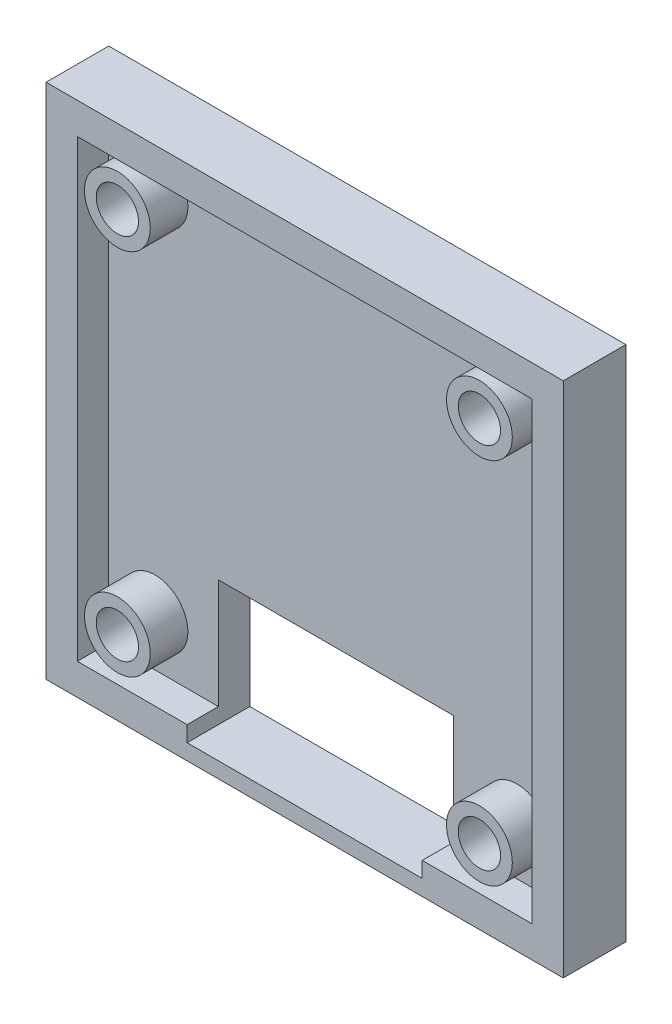
from build123d import *

# Parameters (mm, degrees)
SKETCH1_W           = 33
SKETCH1_H           = 33
SKETCH1_W_2         = 15
SKETCH1_H_2         = 8
SKETCH1_R           = 1.35
BOSS_EXTRUDE1_DEPTH = 2
SKETCH2_R           = 2.1
SKETCH2_R_2         = 1.1
BOSS_EXTRUDE2_DEPTH = 2.4
SKETCH3_W           = 33
SKETCH3_H           = 33
SKETCH3_W_2         = 29
SKETCH3_H_2         = 29
BOSS_EXTRUDE3_DEPTH = 2
SKETCH4_R           = 1.35
CUT_EXTRUDE1_DEPTH  = 10
SKETCH5_W           = 15
SKETCH5_H           = 8
CUT_EXTRUDE2_DEPTH  = 10


with BuildPart() as part:
    # Sketch1 → Boss-Extrude1 (new body)
    with BuildSketch(Plane.XY):
        Rectangle(SKETCH1_W, SKETCH1_H)
        with Locations((0, -11.5)):
            Rectangle(SKETCH1_W_2, SKETCH1_H_2, mode=Mode.SUBTRACT)
        with Locations((11.55, -11.35)):
            Circle(SKETCH1_R, mode=Mode.SUBTRACT)
        with Locations((11.55, 12.15)):
            Circle(SKETCH1_R, mode=Mode.SUBTRACT)
        with Locations((-11.55, 12.15)):
            Circle(SKETCH1_R, mode=Mode.SUBTRACT)
        with Locations((-11.55, -11.35)):
            Circle(SKETCH1_R, mode=Mode.SUBTRACT)
    extrude(amount=BOSS_EXTRUDE1_DEPTH)

    # Sketch2 → Boss-Extrude2 (add)
    # profile 1 of 4: a face of its own
    with BuildSketch(Plane.XY.offset(2)):
        with Locations((-11.55, 12.15)):
            Circle(SKETCH2_R)
        with Locations((-11.55, 12.15)):
            Circle(SKETCH2_R_2, mode=Mode.SUBTRACT)
    # profile 2 of 4: a face of its own
    with BuildSketch(Plane.XY.offset(2)):
        with Locations((-11.55, -11.35)):
            Circle(SKETCH2_R)
        with Locations((-11.55, -11.35)):
            Circle(SKETCH2_R_2, mode=Mode.SUBTRACT)
    # profile 3 of 4: a face of its own
    with BuildSketch(Plane.XY.offset(2)):
        with Locations((11.55, -11.35)):
            Circle(SKETCH2_R)
        with Locations((11.55, -11.35)):
            Circle(SKETCH2_R_2, mode=Mode.SUBTRACT)
    # profile 4 of 4: a face of its own
    with BuildSketch(Plane.XY.offset(2)):
        with Locations((11.55, 12.15)):
            Circle(SKETCH2_R)
        with Locations((11.55, 12.15)):
            Circle(SKETCH2_R_2, mode=Mode.SUBTRACT)
    extrude(amount=BOSS_EXTRUDE2_DEPTH)

    # Sketch3 → Boss-Extrude3 (add)
    with BuildSketch(Plane.XY.offset(2)):
        Rectangle(SKETCH3_W, SKETCH3_H)
        Rectangle(SKETCH3_W_2, SKETCH3_H_2, mode=Mode.SUBTRACT)
    extrude(amount=BOSS_EXTRUDE3_DEPTH)

    # Sketch4 → Cut-Extrude1 (cut)
    with BuildSketch(Plane(origin=(0, 0, 0), x_dir=(-1, 0, 0), z_dir=(0, 0, -1))):
        with Locations((-11.55, 12.15)):
            Circle(SKETCH4_R)
        with Locations((11.55, 12.15)):
            Circle(SKETCH4_R)
        with Locations((11.55, -11.35)):
            Circle(SKETCH4_R)
        with Locations((-11.55, -11.35)):
            Circle(SKETCH4_R)
    extrude(amount=-CUT_EXTRUDE1_DEPTH, mode=Mode.SUBTRACT)

    # Sketch5 → Cut-Extrude2 (cut)
    with BuildSketch(Plane(origin=(0, 0, 0), x_dir=(-1, 0, 0), z_dir=(0, 0, -1))):
        with Locations((0, -11.5)):
            Rectangle(SKETCH5_W, SKETCH5_H)
    extrude(amount=-CUT_EXTRUDE2_DEPTH, mode=Mode.SUBTRACT)


solid = part.part
